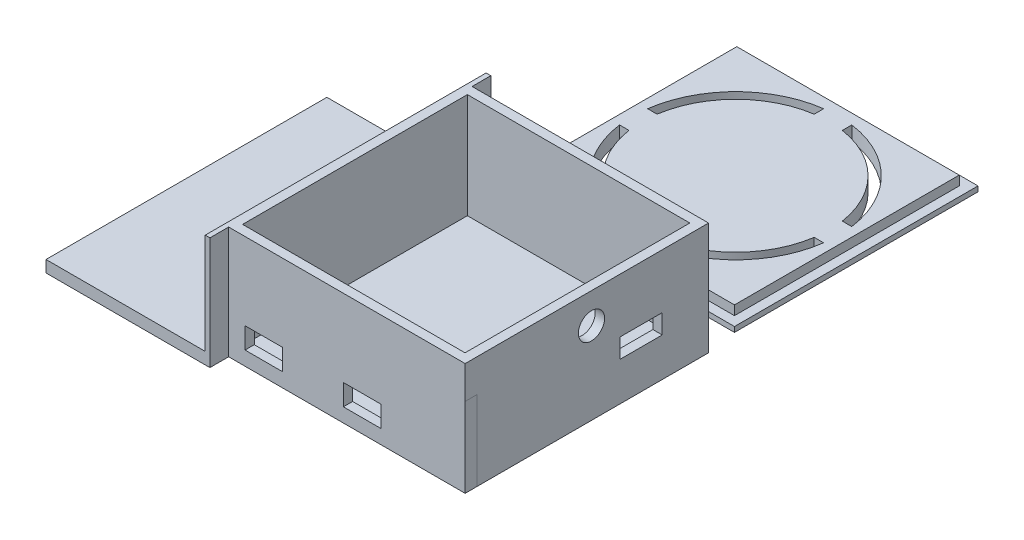
from build123d import *

# Parameters (mm, degrees)
SKETCH1_W                = 45.5
SKETCH1_H                = 45
BOSS_EXTRUDE1_DEPTH      = 1.6
SKETCH2_W                = 45.5
SKETCH2_H                = 45
BOSS_EXTRUDE2_DEPTH      = 24
SKETCH4_W                = 4
SKETCH4_H                = 1.7
CUT_EXTRUDE1_DEPTH       = 1.1
CUT_EXTRUDE3_DEPTH       = 1.1
SKETCH10_R               = 2.5079963
CUT_EXTRUDE4_DEPTH       = 1.1
BOSS_EXTRUDE3_DEPTH      = 0.001
BOSS_EXTRUDE3_DEPTH_BACK = 1.1
SKETCH11_W               = 47.5
SKETCH11_H               = 47
SKETCH13_W               = 45.5
SKETCH13_H               = 45
BOSS_EXTRUDE4_DEPTH      = 2
SKETCH14_R               = 22
SKETCH14_R_2             = 20
CUT_EXTRUDE6_DEPTH       = 13.441794669
SKETCH15_W               = 6
SKETCH15_H               = 7.443647067
BOSS_EXTRUDE6_DEPTH      = 3.097585302
BOSS_EXTRUDE10_DEPTH     = 3.116449364
BOSS_EXTRUDE11_DEPTH     = 1
SKETCH22_W               = 59.97606594
SKETCH22_H               = 1
BOSS_EXTRUDE12_DEPTH     = 34
CUT_EXTRUDE7_DEPTH       = 1.1
SKETCH23_W               = 3
SKETCH23_H               = 3
CUT_EXTRUDE8_DEPTH       = 5
SKETCH24_W               = 46.976120504
SKETCH24_H               = 24
BOSS_EXTRUDE13_DEPTH     = 3
SKETCH25_W               = 50.501685611
SKETCH25_H               = 17
BOSS_EXTRUDE14_DEPTH     = 2.5
SKETCH26_W               = 50.5
SKETCH26_H               = 24
BOSS_EXTRUDE15_DEPTH     = 2.5
SKETCH27_W               = 45.5
SKETCH27_H               = 22.4
CUT_EXTRUDE9_DEPTH       = 1.5
SKETCH28_W               = 45.5
SKETCH28_H               = 22.4
CUT_EXTRUDE10_DEPTH      = 1.5
CUT_EXTRUDE13_START      = -12.5
SKETCH31_R               = 2.5079963
SKETCH31_W               = 8
SKETCH31_H               = 3.5
CUT_EXTRUDE13_DEPTH      = 12.5
SKETCH32_W               = 48
SKETCH32_H               = 22.4
CUT_EXTRUDE14_DEPTH      = 2
SKETCH34_W               = 34
SKETCH34_H               = 59.97606594
BOSS_EXTRUDE16_DEPTH     = 1.5
SKETCH35_W               = 6
SKETCH35_H               = 3
CUT_EXTRUDE15_DEPTH      = 6.5
BOSS_EXTRUDE18_DEPTH     = 7
SKETCH47_W               = 45
SKETCH47_H               = 2
BOSS_EXTRUDE19_DEPTH     = 1
SKETCH49_W               = 45
SKETCH49_H               = 2
BOSS_EXTRUDE20_DEPTH     = 1
SKETCH51_W               = 48.225479337
SKETCH51_H               = 2
BOSS_EXTRUDE21_DEPTH     = 1.5
SKETCH53_W               = 48
SKETCH53_H               = 2
BOSS_EXTRUDE22_DEPTH     = 1.5
SKETCH54_W               = 47.5
SKETCH54_H               = 1.101
BOSS_EXTRUDE23_DEPTH     = 2
SKETCH55_W               = 49
SKETCH55_H               = 1.101
BOSS_EXTRUDE24_DEPTH     = 2
SKETCH56_W               = 49
SKETCH56_H               = 1.101
BOSS_EXTRUDE25_DEPTH     = 2
SKETCH57_W               = 51.5
SKETCH57_H               = 1.101
BOSS_EXTRUDE26_DEPTH     = 2
SKETCH58_W               = 51
SKETCH58_H               = 1.101
BOSS_EXTRUDE27_DEPTH     = 0.5
SKETCH59_W               = 51
SKETCH59_H               = 1.101
BOSS_EXTRUDE28_DEPTH     = 0.5
CUT_EXTRUDE29_START      = -0.5
CUT_EXTRUDE29_OUTLINE_W  = 51
CUT_EXTRUDE29_OUTLINE_H  = 1.101
CUT_EXTRUDE29_DEPTH      = 0.5
SKETCH64_W               = 52
SKETCH64_H               = 1.101
BOSS_EXTRUDE30_DEPTH     = 0.5
CUT_EXTRUDE31_START      = -0.5
CUT_EXTRUDE31_OUTLINE_W  = 51.5
CUT_EXTRUDE31_OUTLINE_H  = 1.101
CUT_EXTRUDE31_DEPTH      = 0.5
SKETCH66_W               = 51.5
SKETCH66_H               = 1.101
BOSS_EXTRUDE32_DEPTH     = 0.5
SKETCH67_W               = 8
SKETCH67_H               = 4.5
CUT_EXTRUDE16_DEPTH      = 10
BOSS_EXTRUDE34_START     = -2
SKETCH70_R               = 2.5079963
BOSS_EXTRUDE34_DEPTH     = 2
SKETCH69_R               = 2.798591497
CUT_EXTRUDE17_DEPTH      = 2
SKETCH80_W               = 8
SKETCH80_H               = 3.5
BOSS_EXTRUDE36_DEPTH     = 1
SKETCH80_2_W             = 8
SKETCH80_2_H             = 3.5
BOSS_EXTRUDE37_DEPTH     = 2
SKETCH80_3_W             = 8
SKETCH80_3_H             = 3.5
CUT_EXTRUDE34_DEPTH      = 2
SKETCH83_W               = 2.5
SKETCH83_H               = 7
CUT_EXTRUDE35_DEPTH      = 2
SKETCH77_W               = 9.045495133
SKETCH77_H               = 4.130087626
CUT_EXTRUDE36_DEPTH      = 2
SKETCH84_W               = 8.684162812
SKETCH84_H               = 3.956527075
BOSS_EXTRUDE38_DEPTH     = 2
SKETCH87_W               = 1.5
SKETCH87_H               = 2
CUT_EXTRUDE38_DEPTH      = 0.73
SKETCH89_W               = 1.5
SKETCH89_H               = 2
CUT_EXTRUDE39_DEPTH      = 0.5


# Read off the part's stored shape, not the designer's step: Cut-Extrude29, Cut-Extrude31
with BuildPart() as part:
    # Sketch1 → Boss-Extrude1 (new body)
    with BuildSketch(Plane(origin=(0, 0, 0), x_dir=(1, 0, 0), z_dir=(0, 1, 0))):
        with Locations((22.75, 22.5)):
            Rectangle(SKETCH1_W, SKETCH1_H)
    extrude(amount=BOSS_EXTRUDE1_DEPTH)

    # Sketch2 → Boss-Extrude2 (add)
    with BuildSketch(Plane.XZ):
        Polygon((0, -46), (46.5, -46), (46.5, -45), (46.5, 0), (46.5, 0.976120504), (0, 0.976120504), (-1, 0.976120504), (-1, -46), align=None)
        with Locations((22.75, -22.5)):
            Rectangle(SKETCH2_W, SKETCH2_H, mode=Mode.SUBTRACT)
    extrude(amount=-BOSS_EXTRUDE2_DEPTH)

    # Sketch4 → Cut-Extrude1 (cut)
    with BuildSketch(Plane.XY.offset(0.976120504)):
        with Locations((4, 3.85)):
            Rectangle(SKETCH4_W, SKETCH4_H)
        with Locations((25, 3.85)):
            Rectangle(SKETCH4_W, SKETCH4_H)
    extrude(amount=-CUT_EXTRUDE1_DEPTH, mode=Mode.SUBTRACT)

    # Sketch9 → Cut-Extrude3 (cut)
    with BuildSketch(Plane(origin=(46.5, 0, 0), x_dir=(0, 0, -1), z_dir=(1, 0, 0))):
        Polygon((36, 4.5), (39.355507427, 4.5), (39.355507427, 8), (31.355507427, 8), (31.355507427, 4.5), align=None)
    extrude(amount=-CUT_EXTRUDE3_DEPTH, mode=Mode.SUBTRACT)

    # Sketch10 → Cut-Extrude4 (cut)
    with BuildSketch(Plane(origin=(46.5, 0, 0), x_dir=(0, 0, -1), z_dir=(1, 0, 0))):
        with Locations((24.5, 13.5)):
            Circle(SKETCH10_R)
    extrude(amount=-CUT_EXTRUDE4_DEPTH, mode=Mode.SUBTRACT)

    # Sketch21 → Boss-Extrude11 (add)
    with BuildSketch(Plane.ZY.offset(1)):
        Polygon((-46, 0), (-52.499972718, 0), (-52.499972718, 17), (7.476093222, 17), (7.476093222, 0), (0.976120504, 0), align=None)
    extrude(amount=BOSS_EXTRUDE11_DEPTH)

    # Sketch22 → Boss-Extrude12 (add)
    with BuildSketch(Plane.ZY.offset(2)):
        with Locations((-22.511939748, 0.5)):
            Rectangle(SKETCH22_W, SKETCH22_H)
    extrude(amount=BOSS_EXTRUDE12_DEPTH)

    # Sketch6 → Cut-Extrude7 (cut)
    with BuildSketch(Plane.XY.offset(0.976120504)):
        Polygon((15, 3), (17.895490388, 3), (17.895490388, 4.5), (12.317203257, 4.5), (12.317203257, 3), align=None)
    extrude(amount=-CUT_EXTRUDE7_DEPTH, mode=Mode.SUBTRACT)

    # Sketch23 → Cut-Extrude8 (cut)
    with BuildSketch(Plane(origin=(0, 0, 0), x_dir=(0, 0, -1), z_dir=(1, 0, 0))):
        with Locations((3, 4.6)):
            Rectangle(SKETCH23_W, SKETCH23_H)
    extrude(amount=-CUT_EXTRUDE8_DEPTH, mode=Mode.SUBTRACT)

    # Sketch24 → Boss-Extrude13 (add)
    with BuildSketch(Plane(origin=(46.5, 0, 0), x_dir=(0, 0, -1), z_dir=(1, 0, 0))):
        with Locations((22.511939748, 12)):
            Rectangle(SKETCH24_W, SKETCH24_H)
    extrude(amount=BOSS_EXTRUDE13_DEPTH)

    # Sketch25 → Boss-Extrude14 (add)
    with BuildSketch(Plane.XY.offset(0.976120504)):
        with Locations((24.250842806, 8.5)):
            Rectangle(SKETCH25_W, SKETCH25_H)
    extrude(amount=BOSS_EXTRUDE14_DEPTH)

    # Sketch26 → Boss-Extrude15 (add)
    with BuildSketch(Plane(origin=(0, 0, -46), x_dir=(-1, 0, 0), z_dir=(0, 0, -1))):
        with Locations((-24.25, 12)):
            Rectangle(SKETCH26_W, SKETCH26_H)
    extrude(amount=BOSS_EXTRUDE15_DEPTH)

    # Sketch27 → Cut-Extrude9 (cut)
    with BuildSketch(Plane.XY.offset(-45)):
        with Locations((22.75, 12.8)):
            Rectangle(SKETCH27_W, SKETCH27_H)
    extrude(amount=-CUT_EXTRUDE9_DEPTH, mode=Mode.SUBTRACT)

    # Sketch28 → Cut-Extrude10 (cut)
    with BuildSketch(Plane(origin=(0, 0, 0), x_dir=(-1, 0, 0), z_dir=(0, 0, -1))):
        with Locations((-22.75, 12.8)):
            Rectangle(SKETCH28_W, SKETCH28_H)
    extrude(amount=-CUT_EXTRUDE10_DEPTH, mode=Mode.SUBTRACT)

    # Sketch31 → Cut-Extrude13 (cut)
    with BuildSketch(Plane.ZY.offset(-46.5).offset(CUT_EXTRUDE13_START)):
        with Locations(Location((-24.5, 13.5, 0), (0, 0, 180))):
            Circle(SKETCH31_R)
        with Locations((-35.355507427, 6.25)):
            Rectangle(SKETCH31_W, SKETCH31_H)
    extrude(amount=CUT_EXTRUDE13_DEPTH, mode=Mode.SUBTRACT)

    # Sketch32 → Cut-Extrude14 (cut)
    with BuildSketch(Plane.ZY.offset(-45.5)):
        with Locations((-22.5, 12.8)):
            Rectangle(SKETCH32_W, SKETCH32_H)
    extrude(amount=-CUT_EXTRUDE14_DEPTH, mode=Mode.SUBTRACT)

    # Sketch34 → Boss-Extrude16 (add)
    with BuildSketch(Plane(origin=(0, 1, 0), x_dir=(1, 0, 0), z_dir=(0, 1, 0))):
        with Locations((-19, 22.511939748)):
            Rectangle(SKETCH34_W, SKETCH34_H)
    extrude(amount=BOSS_EXTRUDE16_DEPTH)

    # Sketch35 → Cut-Extrude15 (cut)
    with BuildSketch(Plane.XY.offset(3.476120504)):
        with Locations((5.5, 4.5)):
            Rectangle(SKETCH35_W, SKETCH35_H)
        with Locations((27.5, 4.5)):
            Rectangle(SKETCH35_W, SKETCH35_H)
    extrude(amount=-CUT_EXTRUDE15_DEPTH, mode=Mode.SUBTRACT)

    # Sketch39 → Boss-Extrude18 (add)
    with BuildSketch(Plane(origin=(0, 17, 0), x_dir=(1, 0, 0), z_dir=(0, 1, 0))):
        Polygon((-2, -7.476093222), (-1, -7.476093222), (-1, -3.476120504), (51.5, -3.476120504), (51.5, -0.976120504), (47.5, -0.976120504), (47.5, -1.5), (0, -1.5), (0, -0.976120504), (-1, -0.976120504), (-1, 52.499972718), (-2, 52.499972718), align=None)
    extrude(amount=BOSS_EXTRUDE18_DEPTH)

    # Sketch67 → Cut-Extrude16 (cut)
    with BuildSketch(Plane.XY.offset(3.476120504)):
        Polygon((27.5, 3), (23.5, 3), (23.5, 7.5), (31.5, 7.5), (31.5, 3), align=None)
        with Locations((6.5, 5.25)):
            Rectangle(SKETCH67_W, SKETCH67_H)
    extrude(amount=-CUT_EXTRUDE16_DEPTH, mode=Mode.SUBTRACT)

    # Sketch70 → Boss-Extrude34 (add)
    with BuildSketch(Plane(origin=(49.5, 0, 0), x_dir=(0, 0, -1), z_dir=(1, 0, 0)).offset(BOSS_EXTRUDE34_START)):
        with Locations((24.5, 13.5)):
            Circle(SKETCH70_R)
    extrude(amount=BOSS_EXTRUDE34_DEPTH)

    # Sketch69 → Cut-Extrude17 (cut)
    with BuildSketch(Plane(origin=(49.5, 0, 0), x_dir=(0, 0, -1), z_dir=(1, 0, 0))):
        with Locations((23.5, 17.5)):
            Circle(SKETCH69_R)
    extrude(amount=-CUT_EXTRUDE17_DEPTH, mode=Mode.SUBTRACT)

    # Sketch80 → Boss-Extrude36 (add)
    with BuildSketch(Plane(origin=(49.5, 0, 0), x_dir=(0, 0, -1), z_dir=(1, 0, 0))):
        with Locations((35.355507427, 6.25)):
            Rectangle(SKETCH80_W, SKETCH80_H)
    extrude(amount=-BOSS_EXTRUDE36_DEPTH)

    # Sketch80<2> → Boss-Extrude37 (add)
    with BuildSketch(Plane(origin=(49.5, 0, 0), x_dir=(0, 0, -1), z_dir=(1, 0, 0))):
        with Locations((35.355507427, 6.25)):
            Rectangle(SKETCH80_2_W, SKETCH80_2_H)
    extrude(amount=-BOSS_EXTRUDE37_DEPTH)

    # Sketch80<3> → Cut-Extrude34 (cut)
    with BuildSketch(Plane(origin=(49.5, 0, 0), x_dir=(0, 0, -1), z_dir=(1, 0, 0))):
        with Locations((35.355507427, 6.25)):
            Rectangle(SKETCH80_3_W, SKETCH80_3_H)
    extrude(amount=-CUT_EXTRUDE34_DEPTH, mode=Mode.SUBTRACT)

    # Sketch83 → Cut-Extrude35 (cut)
    with BuildSketch(Plane(origin=(51.5, 0, 0), x_dir=(0, 0, -1), z_dir=(1, 0, 0))):
        with Locations((-2.226120504, 20.5)):
            Rectangle(SKETCH83_W, SKETCH83_H)
    extrude(amount=-CUT_EXTRUDE35_DEPTH, mode=Mode.SUBTRACT)

    # Sketch77 → Cut-Extrude36 (cut)
    with BuildSketch(Plane(origin=(49.5, 0, 0), x_dir=(0, 0, -1), z_dir=(1, 0, 0))):
        with Locations((34.086201301, 10.316065325)):
            Rectangle(SKETCH77_W, SKETCH77_H)
    extrude(amount=-CUT_EXTRUDE36_DEPTH, mode=Mode.SUBTRACT)

    # Sketch84 → Boss-Extrude38 (add)
    with BuildSketch(Plane(origin=(49.5, 0, 0), x_dir=(0, 0, -1), z_dir=(1, 0, 0))):
        with Locations((35.013426021, 6.021736462)):
            Rectangle(SKETCH84_W, SKETCH84_H)
    extrude(amount=-BOSS_EXTRUDE38_DEPTH)


with BuildPart() as body_2:
    # Sketch11 → Boss-Extrude3 (new, two sides: drawn at the far end of the back side and taken through both)
    with BuildSketch(Plane.XZ.offset(-BOSS_EXTRUDE3_DEPTH_BACK)):
        with Locations((22.75, -81.03168978)):
            Rectangle(SKETCH11_W, SKETCH11_H)
    extrude(amount=BOSS_EXTRUDE3_DEPTH + BOSS_EXTRUDE3_DEPTH_BACK)

    # Sketch13 → Boss-Extrude4 (add)
    with BuildSketch(Plane(origin=(0, 1.1, 0), x_dir=(1, 0, 0), z_dir=(0, 1, 0))):
        with Locations((22.75, 81.03168978)):
            Rectangle(SKETCH13_W, SKETCH13_H)
    extrude(amount=BOSS_EXTRUDE4_DEPTH)

    # Sketch14 → Cut-Extrude6 (cut)
    with BuildSketch(Plane(origin=(0, 3.1, 0), x_dir=(1, 0, 0), z_dir=(0, 1, 0))):
        with Locations(Location((22.75, 81.03168978, 0), (0, 0, 270))):
            Circle(SKETCH14_R)
        with Locations(Location((22.75, 81.03168978, 0), (0, 0, 270))):
            Circle(SKETCH14_R_2, mode=Mode.SUBTRACT)
    extrude(amount=-CUT_EXTRUDE6_DEPTH, mode=Mode.SUBTRACT)


with BuildPart() as cut_extrude6_piece_1:
    # of the separate pieces the step leaves, piece 1, a body of its own (cut_extrude6_pieces)
    add(body_2.part.solids().sort_by_distance((22.75, -0.001, -61.03168978))[0])



with BuildPart() as cut_extrude6_piece_2:
    # of the separate pieces the step leaves, piece 2, a body of its own (cut_extrude6_pieces)
    add(body_2.part.solids().sort_by_distance((-1, -0.001, -57.53168978))[0])


with BuildPart() as cut_extrude6_piece_1_1:
    add(cut_extrude6_piece_1.part)

    add(cut_extrude6_piece_2.part)  # Boss-Extrude6 merges Cut-Extrude6 piece 2
    # Sketch15 → Boss-Extrude6 (add)
    with BuildSketch(Plane(origin=(0, 3.1, 0), x_dir=(1, 0, 0), z_dir=(0, 1, 0))):
        with Locations((22.75, 62.753513314)):
            Rectangle(SKETCH15_W, SKETCH15_H)
    extrude(amount=-BOSS_EXTRUDE6_DEPTH)

    # Sketch16 → Boss-Extrude10 (add)
    with BuildSketch(Plane(origin=(0, 3.1, 0), x_dir=(1, 0, 0), z_dir=(0, 1, 0))):
        with BuildLine():
            ThreePointArc((2.976280067, 78.03168978), (2.75, 81.03168978), (2.976280067, 84.03168978))
            Line((2.976280067, 84.03168978), (0.75, 84.03168978))
            Line((0.75, 84.03168978), (0.75, 81.03168978))
            Line((0.75, 81.03168978), (0.75, 78.03168978))
            Line((0.75, 78.03168978), (2.976280067, 78.03168978))
        make_face()
        with BuildLine():
            Line((25.75, 103.03168978), (22.75, 103.03168978))
            Line((22.75, 103.03168978), (19.75, 103.03168978))
            Line((19.75, 103.03168978), (19.75, 100.805409714))
            ThreePointArc((19.75, 100.805409714), (22.75, 101.03168978), (25.75, 100.805409714))
            Line((25.75, 100.805409714), (25.75, 103.03168978))
        make_face()
        with BuildLine():
            Line((44.75, 84.03168978), (42.523719933, 84.03168978))
            ThreePointArc((42.523719933, 84.03168978), (42.693349752, 82.535950618), (42.75, 81.03168978))
            ThreePointArc((42.75, 81.03168978), (42.693349752, 79.527428943), (42.523719933, 78.03168978))
            Line((42.523719933, 78.03168978), (44.75, 78.03168978))
            Line((44.75, 78.03168978), (44.75, 81.03168978))
            Line((44.75, 81.03168978), (44.75, 84.03168978))
        make_face()
    extrude(amount=-BOSS_EXTRUDE10_DEPTH)

    # Sketch47 → Boss-Extrude19 (add)
    with BuildSketch(Plane(origin=(45.5, 0, 0), x_dir=(0, 0, -1), z_dir=(1, 0, 0))):
        with Locations((81.03168978, 2.1)):
            Rectangle(SKETCH47_W, SKETCH47_H)
    extrude(amount=BOSS_EXTRUDE19_DEPTH)

    # Sketch49 → Boss-Extrude20 (add)
    with BuildSketch(Plane.ZY):
        with Locations((-81.03168978, 2.1)):
            Rectangle(SKETCH49_W, SKETCH49_H)
    extrude(amount=BOSS_EXTRUDE20_DEPTH)

    # Sketch51 → Boss-Extrude21 (add)
    with BuildSketch(Plane(origin=(0, 0, -103.53168978), x_dir=(-1, 0, 0), z_dir=(0, 0, -1))):
        with Locations((-22.387260331, 2.1)):
            Rectangle(SKETCH51_W, SKETCH51_H)
    extrude(amount=BOSS_EXTRUDE21_DEPTH)

    # Sketch53 → Boss-Extrude22 (add)
    with BuildSketch(Plane.XY.offset(-58.53168978)):
        with Locations((23, 2.1)):
            Rectangle(SKETCH53_W, SKETCH53_H)
    extrude(amount=BOSS_EXTRUDE22_DEPTH)

    # Sketch54 → Boss-Extrude23 (add)
    with BuildSketch(Plane(origin=(0, 0, -104.53168978), x_dir=(-1, 0, 0), z_dir=(0, 0, -1))):
        with Locations((-22.75, 0.5495)):
            Rectangle(SKETCH54_W, SKETCH54_H)
    extrude(amount=BOSS_EXTRUDE23_DEPTH)

    # Sketch55 → Boss-Extrude24 (add)
    with BuildSketch(Plane.ZY.offset(1)):
        with Locations((-82.03168978, 0.5495)):
            Rectangle(SKETCH55_W, SKETCH55_H)
    extrude(amount=BOSS_EXTRUDE24_DEPTH)

    # Sketch56 → Boss-Extrude25 (add)
    with BuildSketch(Plane(origin=(46.5, 0, 0), x_dir=(0, 0, -1), z_dir=(1, 0, 0))):
        with Locations((82.03168978, 0.5495)):
            Rectangle(SKETCH56_W, SKETCH56_H)
    extrude(amount=BOSS_EXTRUDE25_DEPTH)

    # Sketch57 → Boss-Extrude26 (add)
    with BuildSketch(Plane.XY.offset(-57.53168978)):
        with Locations((22.75, 0.5495)):
            Rectangle(SKETCH57_W, SKETCH57_H)
    extrude(amount=BOSS_EXTRUDE26_DEPTH)

    # Sketch58 → Boss-Extrude27 (add)
    with BuildSketch(Plane(origin=(48.5, 0, 0), x_dir=(0, 0, -1), z_dir=(1, 0, 0))):
        with Locations((81.03168978, 0.5495)):
            Rectangle(SKETCH58_W, SKETCH58_H)
    extrude(amount=BOSS_EXTRUDE27_DEPTH)

    # Sketch59 → Boss-Extrude28 (add)
    with BuildSketch(Plane.ZY.offset(3)):
        with Locations((-81.03168978, 0.5495)):
            Rectangle(SKETCH59_W, SKETCH59_H)
    extrude(amount=BOSS_EXTRUDE28_DEPTH)

    # Cut-Extrude29 outline → Cut-Extrude29 (cut)
    with BuildSketch(Plane(origin=(49, 0, 0), x_dir=(0, 0, -1), z_dir=(1, 0, 0)).offset(CUT_EXTRUDE29_START)):
        with Locations((81.03168978, 0.5495)):
            Rectangle(CUT_EXTRUDE29_OUTLINE_W, CUT_EXTRUDE29_OUTLINE_H)
    extrude(amount=CUT_EXTRUDE29_DEPTH, mode=Mode.SUBTRACT)

    # Sketch64 → Boss-Extrude30 (add)
    with BuildSketch(Plane(origin=(0, 0, -106.53168978), x_dir=(-1, 0, 0), z_dir=(0, 0, -1))):
        with Locations((-22.5, 0.5495)):
            Rectangle(SKETCH64_W, SKETCH64_H)
    extrude(amount=BOSS_EXTRUDE30_DEPTH)

    # Cut-Extrude31 outline → Cut-Extrude31 (cut)
    with BuildSketch(Plane.ZY.offset(3.5).offset(CUT_EXTRUDE31_START)):
        with Locations((-81.28168978, 0.5495)):
            Rectangle(CUT_EXTRUDE31_OUTLINE_W, CUT_EXTRUDE31_OUTLINE_H)
    extrude(amount=CUT_EXTRUDE31_DEPTH, mode=Mode.SUBTRACT)

    # Sketch66 → Boss-Extrude32 (add)
    with BuildSketch(Plane.XY.offset(-55.53168978)):
        with Locations((22.75, 0.5495)):
            Rectangle(SKETCH66_W, SKETCH66_H)
    extrude(amount=BOSS_EXTRUDE32_DEPTH)

    # Sketch87 → Cut-Extrude38 (cut)
    with BuildSketch(Plane.ZY.offset(1.725479337)):
        with Locations((-104.28168978, 2.1)):
            Rectangle(SKETCH87_W, SKETCH87_H)
    extrude(amount=-CUT_EXTRUDE38_DEPTH, mode=Mode.SUBTRACT)

    # Sketch89 → Cut-Extrude39 (cut)
    with BuildSketch(Plane(origin=(47, 0, 0), x_dir=(0, 0, -1), z_dir=(1, 0, 0))):
        with Locations((57.78168978, 2.1)):
            Rectangle(SKETCH89_W, SKETCH89_H)
    extrude(amount=-CUT_EXTRUDE39_DEPTH, mode=Mode.SUBTRACT)


solid = Compound([part.part, cut_extrude6_piece_1_1.part])
